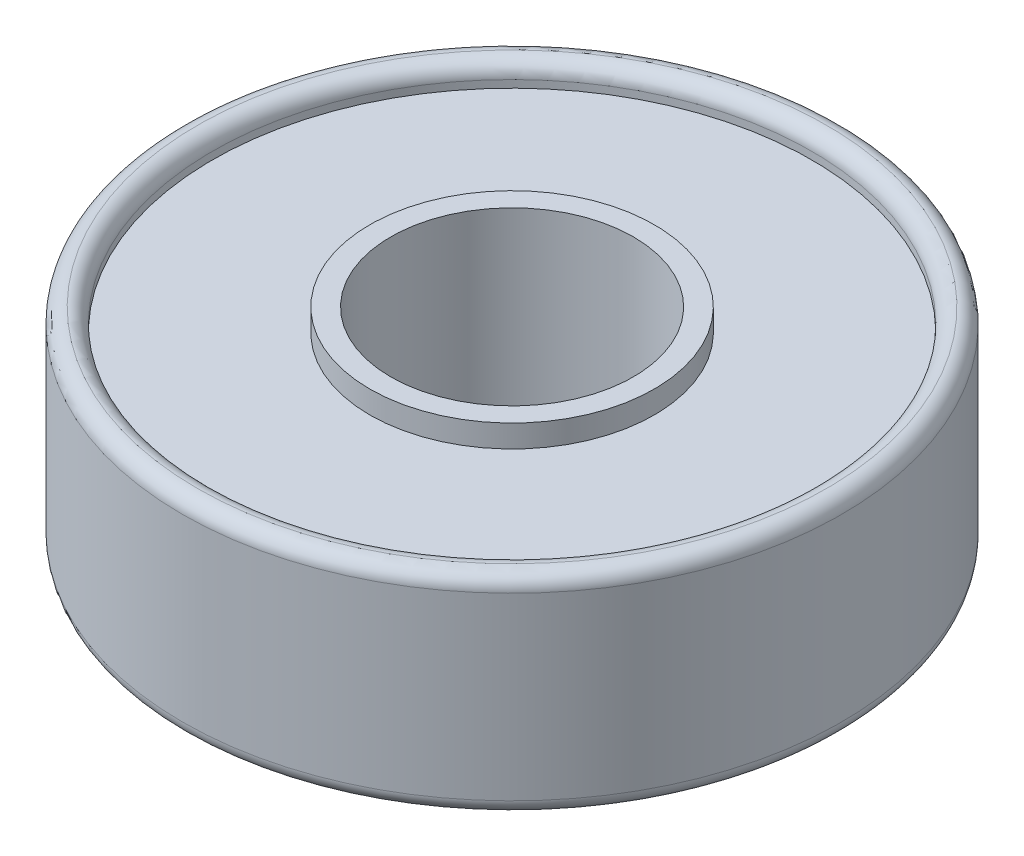
from build123d import *

# Parameters (mm, degrees)
SKETCH1_R               = 11
BOSS_EXTRUDE1_DEPTH     = 3.5
CUT_EXTRUDE1_DEPTH      = 16.945218719
CUT_EXTRUDE1_DEPTH_BACK = 16.945218719
SKETCH2_R               = 10
SKETCH3_R               = 10
BOSS_EXTRUDE2_DEPTH     = 2.75
CUT_EXTRUDE2_DEPTH      = 16.945218719
CUT_EXTRUDE2_DEPTH_BACK = 16.945218719
SKETCH4_R               = 4.75
SKETCH5_R               = 4.75
BOSS_EXTRUDE3_DEPTH     = 3.5
CUT_EXTRUDE3_DEPTH      = 16.945218719
CUT_EXTRUDE3_DEPTH_BACK = 16.945218719
SKETCH6_R               = 4.05
FILLET1_R               = 0.5


with BuildPart() as part:
    # Sketch1 → Boss-Extrude1 (new, symmetric)
    with BuildSketch(Plane(origin=(0, 0, 0), x_dir=(1, 0, 0), z_dir=(0, 1, 0))):
        with Locations(Location((0, 0, 0), (0, 0, 270))):
            Circle(SKETCH1_R)
    extrude(amount=BOSS_EXTRUDE1_DEPTH, both=True)

    # Sketch2 → Cut-Extrude1 (cut, two sides: drawn at the far end of the back side and taken through both)
    with BuildSketch(Plane(origin=(0, 0, 0), x_dir=(1, 0, 0), z_dir=(0, 1, 0)).offset(-CUT_EXTRUDE1_DEPTH_BACK)):
        with Locations(Location((0, 0, 0), (0, 0, 270))):
            Circle(SKETCH2_R)
    extrude(amount=CUT_EXTRUDE1_DEPTH + CUT_EXTRUDE1_DEPTH_BACK, mode=Mode.SUBTRACT)

    # Sketch3 → Boss-Extrude2 (add, symmetric)
    with BuildSketch(Plane(origin=(0, 0, 0), x_dir=(1, 0, 0), z_dir=(0, 1, 0))):
        with Locations(Location((0, 0, 0), (0, 0, 270))):
            Circle(SKETCH3_R)
    extrude(amount=BOSS_EXTRUDE2_DEPTH, both=True)

    # Sketch4 → Cut-Extrude2 (cut, two sides: drawn at the far end of the back side and taken through both)
    with BuildSketch(Plane(origin=(0, 0, 0), x_dir=(1, 0, 0), z_dir=(0, 1, 0)).offset(-CUT_EXTRUDE2_DEPTH_BACK)):
        with Locations(Location((0, 0, 0), (0, 0, 270))):
            Circle(SKETCH4_R)
    extrude(amount=CUT_EXTRUDE2_DEPTH + CUT_EXTRUDE2_DEPTH_BACK, mode=Mode.SUBTRACT)

    # Sketch5 → Boss-Extrude3 (add, symmetric)
    with BuildSketch(Plane(origin=(0, 0, 0), x_dir=(1, 0, 0), z_dir=(0, 1, 0))):
        with Locations(Location((0, 0, 0), (0, 0, 270))):
            Circle(SKETCH5_R)
    extrude(amount=BOSS_EXTRUDE3_DEPTH, both=True)

    # Sketch6 → Cut-Extrude3 (cut, two sides: drawn at the far end of the back side and taken through both)
    with BuildSketch(Plane(origin=(0, 0, 0), x_dir=(1, 0, 0), z_dir=(0, 1, 0)).offset(-CUT_EXTRUDE3_DEPTH_BACK)):
        with Locations(Location((0, 0, 0), (0, 0, 270))):
            Circle(SKETCH6_R)
    extrude(amount=CUT_EXTRUDE3_DEPTH + CUT_EXTRUDE3_DEPTH_BACK, mode=Mode.SUBTRACT)

    # Fillet1
    fillet1_edges = [part.edges().sort_by_distance(p)[0] for p in [
        (0, -3.5, -11),
        (0, 3.5, -11),
        (0, -3.5, -10),
        (0, 3.5, -10),
    ]]
    fillet(fillet1_edges, radius=FILLET1_R - 0.0001)  # a hair under: the kernel refuses the full size


solid = part.part
